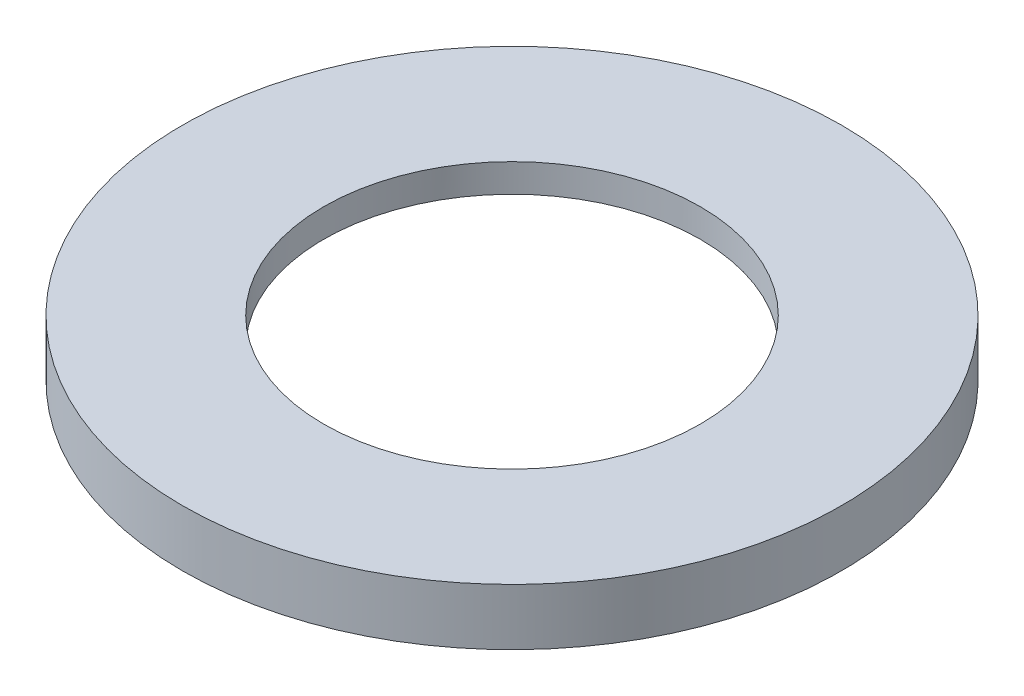
from build123d import *

# Parameters (mm, degrees)
SKETCH1_R           = 35
SKETCH1_R_2         = 20
BOSS_EXTRUDE1_DEPTH = 6
SKETCH2_W           = 7.5
SKETCH2_H           = 3


with BuildPart() as part:
    # Sketch1 → Boss-Extrude1 (new body)
    with BuildSketch(Plane(origin=(0, 0, 0), x_dir=(1, 0, 0), z_dir=(0, 1, 0))):
        Circle(SKETCH1_R)
        Circle(SKETCH1_R_2, mode=Mode.SUBTRACT)
    extrude(amount=BOSS_EXTRUDE1_DEPTH)

    # Sketch2 → Cut-Revolve1 (revolve, cut)
    with BuildSketch(Plane(origin=(0, 0, 0), x_dir=(0, 0, -1), z_dir=(1, 0, 0))):
        with Locations((-23.75, 1.5)):
            Rectangle(SKETCH2_W, SKETCH2_H)
    revolve(axis=Axis((0, 0, 0), (0, 1, 0)), mode=Mode.SUBTRACT)


solid = part.part
